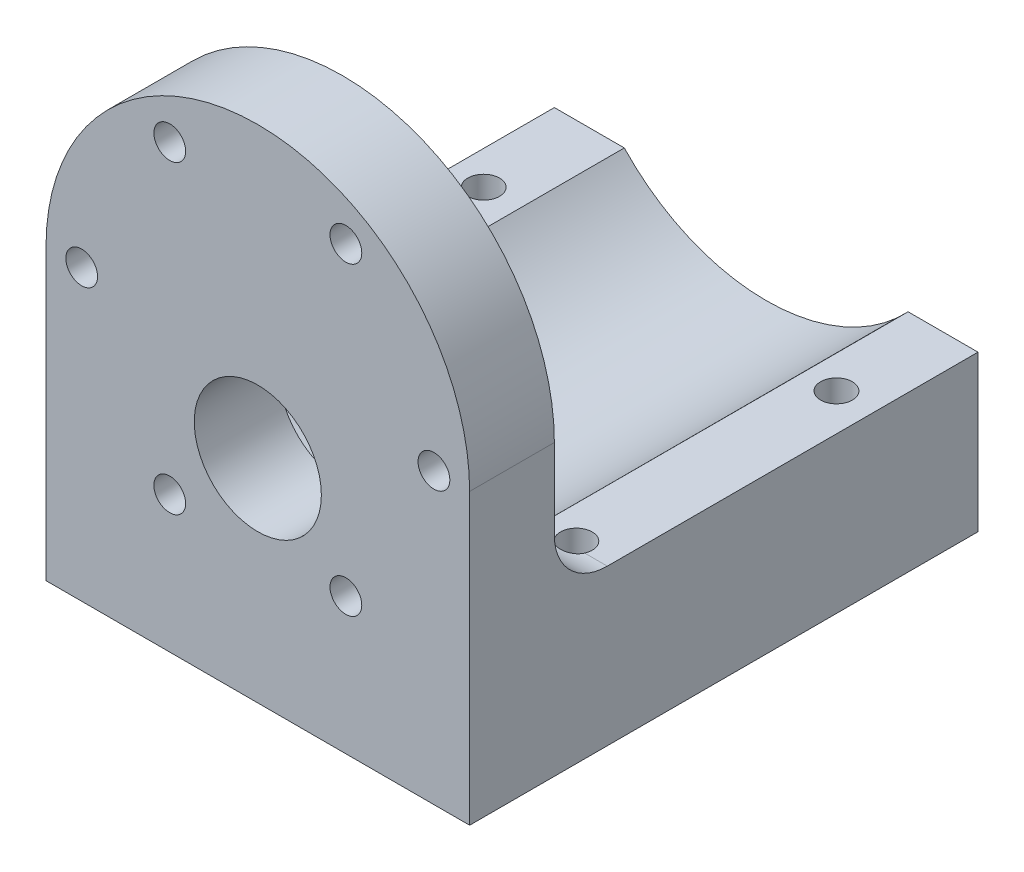
from build123d import *

# Parameters (mm, degrees)
EXTRUDE_2_DEPTH         = 8
SKETCH_1_11_OUTSIDE_W   = 54.492
SKETCH_1_11_OUTSIDE_H   = 61.792
SKETCH_1_11_OUTSIDE_R   = 6
SKETCH_1_11_OUTSIDE_R_2 = 1.5
CUT_EXTRUDE_2_DEPTH     = 63.460307396
EXTRUDE_4_DEPTH         = 40
SKETCH_9_R              = 1.5
CUT_EXTRUDE_3_DEPTH     = 66.295934524
FILLET_1_R              = 5
FILLET_2_R              = 5


with BuildPart() as part:
    # Эскиз1 → Бобышка-Вытянуть2 (new body)
    with BuildSketch(Plane.XY):
        with BuildLine():
            Line((0, 0), (40, 0))
            Line((40, 0), (40, 27.3))
            ThreePointArc((40, 27.3), (20, 47.3), (0, 27.3))
            Line((0, 27.3), (0, 0))
        make_face()
    extrude(amount=EXTRUDE_2_DEPTH)

    # Эскиз1<11> outside → Вырез-Вытянуть2 (cut, through all)
    # profile 1 of 8: a face of its own
    with BuildSketch(Plane.XY):
        with Locations((20, 23.65)):
            Rectangle(SKETCH_1_11_OUTSIDE_W, SKETCH_1_11_OUTSIDE_H)
        with BuildLine():
            Line((0, 0), (40, 0))
            Line((40, 0), (40, 27.3))
            ThreePointArc((40, 27.3), (20, 47.3), (0, 27.3))
            Line((0, 27.3), (0, 0))
        make_face(mode=Mode.SUBTRACT)
    # profile 2 of 8: a face of its own
    with BuildSketch(Plane.XY):
        with Locations((20, 20)):
            Circle(SKETCH_1_11_OUTSIDE_R)
    # profile 3 of 8: a face of its own
    with BuildSketch(Plane.XY):
        with Locations((3.37, 27.3)):
            Circle(SKETCH_1_11_OUTSIDE_R_2)
    # profile 4 of 8: a face of its own
    with BuildSketch(Plane.XY):
        with Locations((11.685, 41.702002465)):
            Circle(SKETCH_1_11_OUTSIDE_R_2)
    # profile 5 of 8: a face of its own
    with BuildSketch(Plane.XY):
        with Locations((28.315, 41.702002465)):
            Circle(SKETCH_1_11_OUTSIDE_R_2)
    # profile 6 of 8: a face of its own
    with BuildSketch(Plane.XY):
        with Locations((36.63, 27.3)):
            Circle(SKETCH_1_11_OUTSIDE_R_2)
    # profile 7 of 8: a face of its own
    with BuildSketch(Plane.XY):
        with Locations((28.315, 12.897997535)):
            Circle(SKETCH_1_11_OUTSIDE_R_2)
    # profile 8 of 8: a face of its own
    with BuildSketch(Plane.XY):
        with Locations((11.685, 12.897997535)):
            Circle(SKETCH_1_11_OUTSIDE_R_2)
    extrude(amount=CUT_EXTRUDE_2_DEPTH, mode=Mode.SUBTRACT)

    # Эскиз8 → Бобышка-Вытянуть4 (add)
    with BuildSketch(Plane(origin=(0, 0, 0), x_dir=(-1, 0, 0), z_dir=(0, 0, -1))):
        with BuildLine():
            Line((-33.397427614, 14.687746699), (-40, 14.687746699))
            Line((-40, 14.687746699), (-40, 0))
            Line((-40, 0), (0, 0))
            Line((0, 0), (0, 14.687746699))
            Line((0, 14.687746699), (-6.602572386, 14.687746699))
            ThreePointArc((-6.602572386, 14.687746699), (-20, 8.9), (-33.397427614, 14.687746699))
        make_face()
    extrude(amount=EXTRUDE_4_DEPTH)

    # Эскиз9 → Вырез-Вытянуть3 (cut, through all)
    with BuildSketch(Plane(origin=(0, 14.687746699, 0), x_dir=(1, 0, 0), z_dir=(0, 1, 0))):
        with Locations(Location((36.487813402, 5.586160045, 0), (0, 0, 270))):
            Circle(SKETCH_9_R)
        with Locations(Location((3.174622012, 5.586160045, 0), (0, 0, 270))):
            Circle(SKETCH_9_R)
        with Locations(Location((3.174622012, 30.147789022, 0), (0, 0, 270))):
            Circle(SKETCH_9_R)
        with Locations(Location((36.487813402, 30.147789022, 0), (0, 0, 270))):
            Circle(SKETCH_9_R)
    extrude(amount=-CUT_EXTRUDE_3_DEPTH, mode=Mode.SUBTRACT)

    # Скругление1
    # the kernel refuses this fillet: 5 mm, written as the material it adds along each edge
    with BuildSketch(Plane(origin=(20.897427614, 14.687746699, 0), x_dir=(0, 1, 0), z_dir=(1, 0, 0))) as fillet_1_piece_1_section:
        with BuildLine():
            CenterArc((FILLET_1_R, -FILLET_1_R), FILLET_1_R, 90, 90)
            Line((0, -FILLET_1_R), (0, 0))
            Line((0, 0), (FILLET_1_R, 0))
        make_face()
    fillet_1_piece_1 = extrude(amount=19.102572386, mode=Mode.PRIVATE)
    fillet_1_piece_1 = fillet_1_piece_1 - Plane(origin=(20, 27.3, -1.204390543), x_dir=(-0.7281210659848666, -0.6854485489583165, 0), z_dir=(0, 0, 1)) * Cylinder(18.4, 59, mode=Mode.PRIVATE)
    fillet_1_piece_1 = fillet_1_piece_1 - Plane(origin=(36.487813402, 15.674506784, -5.586160045), x_dir=(0, 0, 1), z_dir=(0, 1, 0)) * Cylinder(1.5, 59, mode=Mode.PRIVATE)
    add(fillet_1_piece_1)

    # Скругление2
    # the kernel refuses this fillet: 5 mm, written as the material it adds along each edge
    with BuildSketch(Plane(origin=(0, 14.687746699, 0), x_dir=(0, 0, -1), z_dir=(1, 0, 0))) as fillet_2_piece_1_section:
        with BuildLine():
            CenterArc((FILLET_2_R, FILLET_2_R), FILLET_2_R, 180, 90)
            Line((0, FILLET_2_R), (0, 0))
            Line((0, 0), (FILLET_2_R, 0))
        make_face()
    fillet_2_piece_1 = extrude(amount=19.102572386, mode=Mode.PRIVATE)
    fillet_2_piece_1 = fillet_2_piece_1 - Plane(origin=(20, 27.3, -1.204389903), x_dir=(-0.7281210659850873, -0.6854485489580822, 0), z_dir=(0, 0, 1)) * Cylinder(18.4, 59, mode=Mode.PRIVATE)
    fillet_2_piece_1 = fillet_2_piece_1 - Plane(origin=(3.174622012, 15.67450541, -5.586160045), x_dir=(0, 0, 1), z_dir=(0, 1, 0)) * Cylinder(1.5, 59, mode=Mode.PRIVATE)
    add(fillet_2_piece_1)


solid = part.part
